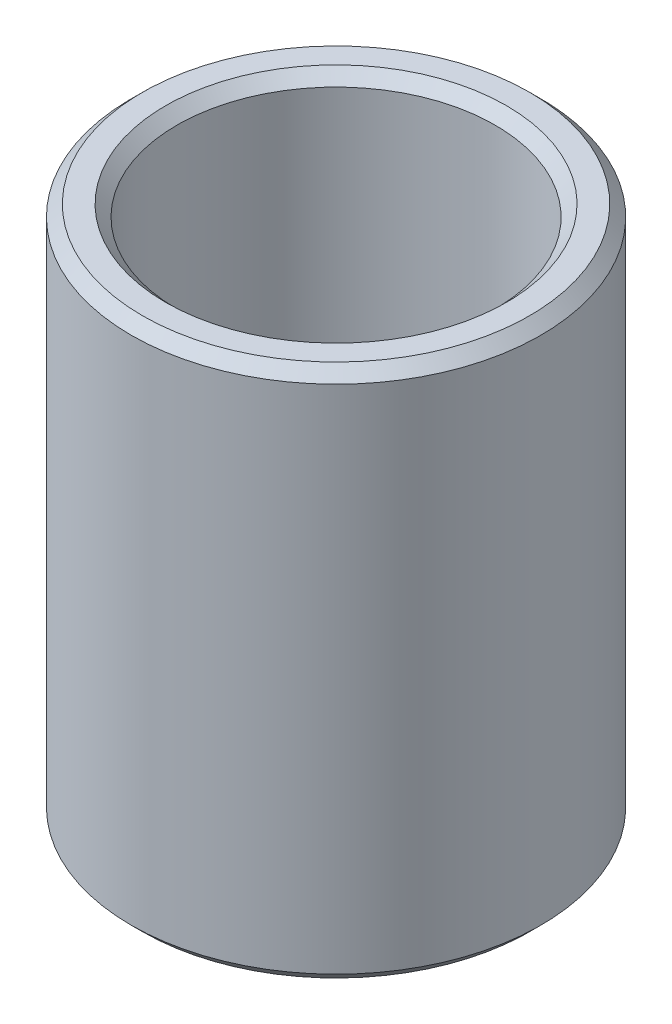
from build123d import *

# Parameters (mm, degrees)
SKETCH1_R           = 30
BOSS_EXTRUDE1_DEPTH = 78.136944274
SKETCH2_R           = 23.31252165
CUT_EXTRUDE1_DEPTH  = 89.912215474
CHAMFER1_SIZE       = 1.648890021


with BuildPart() as part:
    # Sketch1 → Boss-Extrude1 (new body)
    with BuildSketch(Plane(origin=(0, 0, 0), x_dir=(1, 0, 0), z_dir=(0, 1, 0))):
        Circle(SKETCH1_R)
    extrude(amount=BOSS_EXTRUDE1_DEPTH)

    # Sketch2 → Cut-Extrude1 (cut, through all)
    with BuildSketch(Plane(origin=(0, 0, 0), x_dir=(1, 0, 0), z_dir=(0, 1, 0))):
        Circle(SKETCH2_R)
    extrude(amount=CUT_EXTRUDE1_DEPTH, mode=Mode.SUBTRACT)

    # Chamfer1
    chamfer1_edges = [part.edges().sort_by_distance(p)[0] for p in [
        (-23.31252165, 78.136944274, 0),
        (-23.31252165, 0, 0),
        (-30, 0, 0),
        (-30, 78.136944274, 0),
    ]]
    chamfer(chamfer1_edges, length=CHAMFER1_SIZE)


solid = part.part
